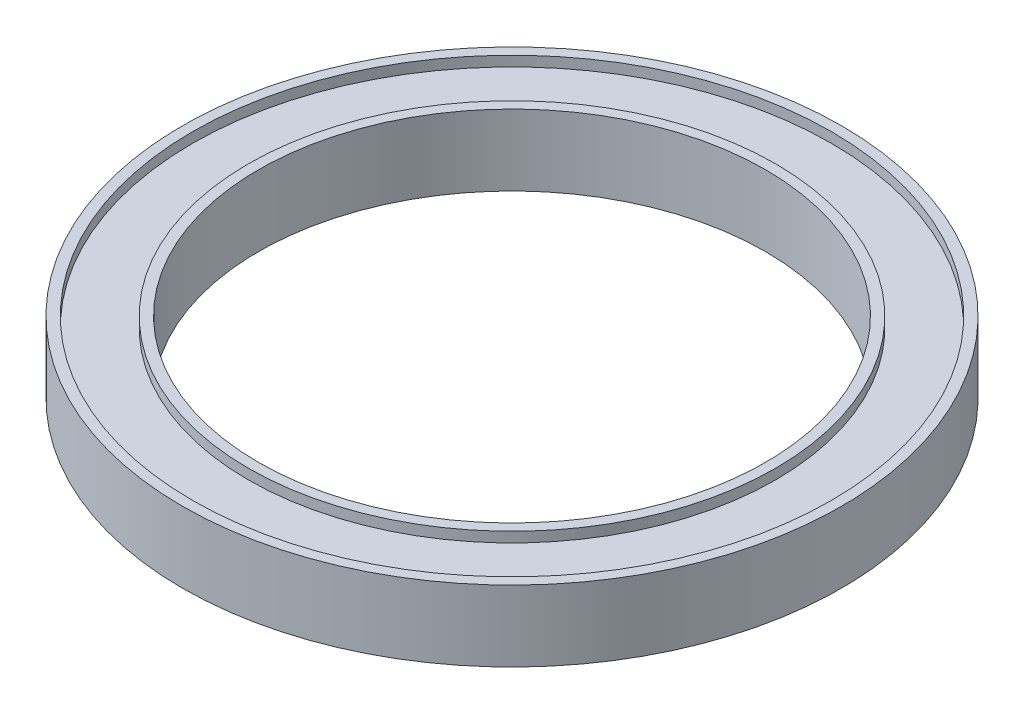
from build123d import *

# Parameters (mm, degrees)
SKETCH1_R             = 32.5
SKETCH1_R_2           = 25
BOSS_EXTRUDE1_DEPTH   = 7
SKETCH2_R             = 31.5
SKETCH2_R_2           = 26
CUT_EXTRUDE1_DEPTH    = 0.5
MIRROR1_OUTLINE_R     = 31.5
MIRROR1_OUTLINE_R_2   = 26
MIRROR1_DEPTH         = 0.5
MIRROR1_START         = 6
MIRROR1_2_OUTLINE_R   = 31.5
MIRROR1_2_OUTLINE_R_2 = 26
MIRROR1_2_DEPTH       = 0.5


# Read off the part's stored shape, not the designer's step: Mirror1
with BuildPart() as part:
    # Sketch1 → Boss-Extrude1 (new body)
    with BuildSketch(Plane(origin=(0, 0, 0), x_dir=(1, 0, 0), z_dir=(0, 1, 0))):
        with Locations(Location((0, 0, 0), (0, 0, 90))):
            Circle(SKETCH1_R)
        with Locations(Location((0, 0, 0), (0, 0, 90))):
            Circle(SKETCH1_R_2, mode=Mode.SUBTRACT)
    extrude(amount=BOSS_EXTRUDE1_DEPTH)

    # Sketch2 → Cut-Extrude1 (cut)
    with BuildSketch(Plane(origin=(0, 7, 0), x_dir=(1, 0, 0), z_dir=(0, 1, 0))):
        with Locations(Location((0, 0, 0), (0, 0, 270))):
            Circle(SKETCH2_R)
        with Locations(Location((0, 0, 0), (0, 0, 270))):
            Circle(SKETCH2_R_2, mode=Mode.SUBTRACT)
    extrude(amount=-CUT_EXTRUDE1_DEPTH, mode=Mode.SUBTRACT)

    # Mirror1 outline → Mirror1 (cut)
    with BuildSketch(Plane(origin=(0, 0, 0), x_dir=(1, 0, 0), z_dir=(0, 1, 0))):
        Circle(MIRROR1_OUTLINE_R)
        Circle(MIRROR1_OUTLINE_R_2, mode=Mode.SUBTRACT)
    extrude(amount=MIRROR1_DEPTH, mode=Mode.SUBTRACT)

    # Mirror1 2 outline → Mirror1 2 (cut)
    with BuildSketch(Plane(origin=(0, 0, 0), x_dir=(1, 0, 0), z_dir=(0, 1, 0)).offset(MIRROR1_START)):
        Circle(MIRROR1_2_OUTLINE_R)
        Circle(MIRROR1_2_OUTLINE_R_2, mode=Mode.SUBTRACT)
    extrude(amount=MIRROR1_2_DEPTH, mode=Mode.SUBTRACT)


solid = part.part
